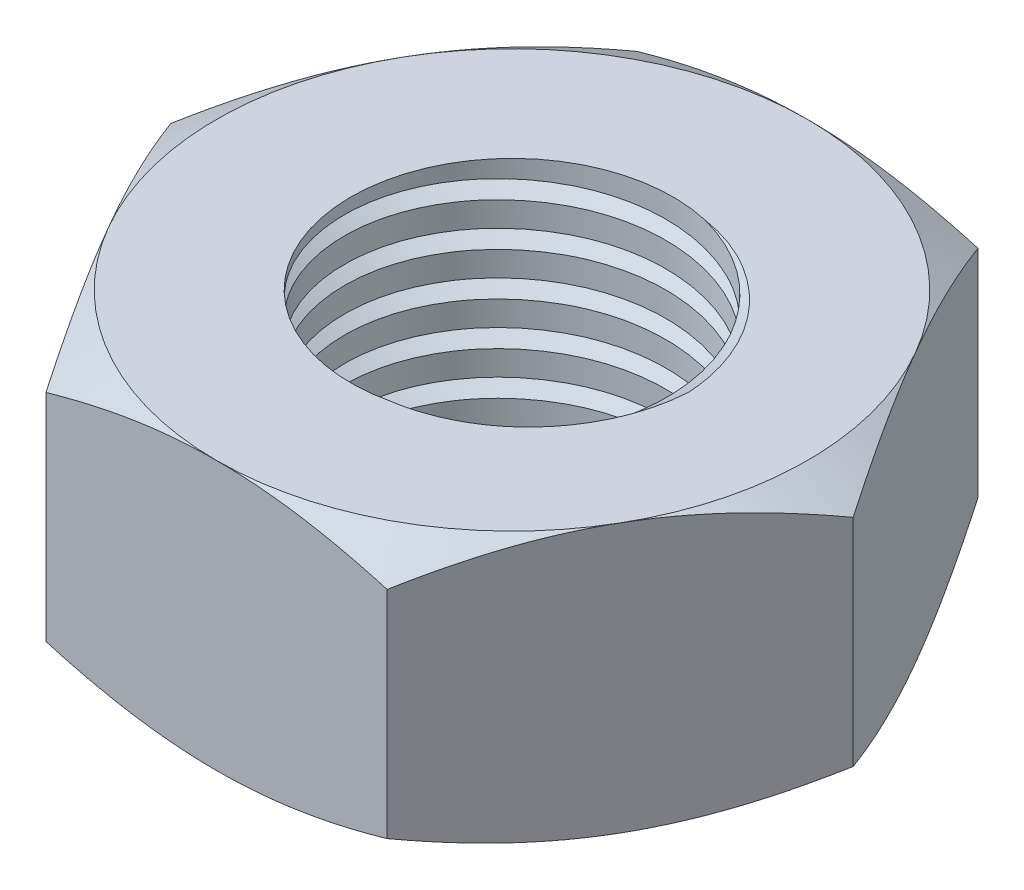
from build123d import *

# Parameters (mm, degrees)
BOSS_EXTRUDE1_DEPTH = 2.5
SKETCH2_R           = 1.5
CUT_EXTRUDE1_DEPTH  = 2.5
SKETCH3_OUTSIDE_W   = 11.836
SKETCH3_OUTSIDE_H   = 10.986
SKETCH3_OUTSIDE_R   = 2.75
CUT_EXTRUDE3_DEPTH  = 0.5
CUT_EXTRUDE3_DRAFT  = -60
SKETCH4_OUTSIDE_W   = 11.836
SKETCH4_OUTSIDE_H   = 10.986
SKETCH4_OUTSIDE_R   = 2.75
CUT_EXTRUDE4_DEPTH  = 0.5
CUT_EXTRUDE4_DRAFT  = -60
CUT_SWEEP1_PITCH    = 0.4


with BuildPart() as part:
    # Sketch1 → Boss-Extrude1 (new body)
    with BuildSketch(Plane(origin=(0, 0, 0), x_dir=(1, 0, 0), z_dir=(0, 1, 0))):
        Polygon((3.175426481, 0), (1.58771324, 2.75), (-1.58771324, 2.75), (-3.175426481, 0), (-1.58771324, -2.75), (1.58771324, -2.75), align=None)
    extrude(amount=BOSS_EXTRUDE1_DEPTH)

    # Sketch2 → Cut-Extrude1 (cut)
    with BuildSketch(Plane(origin=(0, 2.5, 0), x_dir=(1, 0, 0), z_dir=(0, 1, 0))):
        with Locations(Location((0, 0, 0), (0, 0, 270))):
            Circle(SKETCH2_R)
    extrude(amount=-CUT_EXTRUDE1_DEPTH, mode=Mode.SUBTRACT)


with BuildPart() as cut_extrude3_tool:
    # Sketch3 outside → Cut-Extrude3 (with draft: the straight prism first)
    with BuildSketch(Plane(origin=(0, 2.5, 0), x_dir=(1, 0, 0), z_dir=(0, 1, 0))):
        Rectangle(SKETCH3_OUTSIDE_W, SKETCH3_OUTSIDE_H)
        Circle(SKETCH3_OUTSIDE_R, mode=Mode.SUBTRACT)
    extrude(amount=-CUT_EXTRUDE3_DEPTH)
    # Cut-Extrude3: the draft: its side faces are tilted about the plane it starts from
    cut_extrude3_sides = [cut_extrude3_tool.faces().sort_by_distance(p)[0] for p in [
        (0, 2.25, 5.493),
        (5.918, 2.25, 0),
        (0, 2.25, -5.493),
        (-5.918, 2.25, 0),
        (-2.75, 2.25, 0),
    ]]
    draft(cut_extrude3_sides, Plane(origin=(0, 2.5, 0), x_dir=(1, 0, 0), z_dir=(0, 1, 0)), CUT_EXTRUDE3_DRAFT)


with BuildPart() as part_1:
    add(part.part)

    # Cut-Extrude3: cut by cut_extrude3_tool
    add(cut_extrude3_tool.part, mode=Mode.SUBTRACT)


with BuildPart() as cut_extrude4_tool:
    # Sketch4 outside → Cut-Extrude4 (with draft: the straight prism first)
    with BuildSketch(Plane.XZ):
        Rectangle(SKETCH4_OUTSIDE_W, SKETCH4_OUTSIDE_H)
        Circle(SKETCH4_OUTSIDE_R, mode=Mode.SUBTRACT)
    extrude(amount=-CUT_EXTRUDE4_DEPTH)
    # Cut-Extrude4: the draft: its side faces are tilted about the plane it starts from
    cut_extrude4_sides = [cut_extrude4_tool.faces().sort_by_distance(p)[0] for p in [
        (0, 0.25, -5.493),
        (5.918, 0.25, 0),
        (0, 0.25, 5.493),
        (-5.918, 0.25, 0),
        (-2.75, 0.25, 0),
    ]]
    draft(cut_extrude4_sides, Plane.XZ, CUT_EXTRUDE4_DRAFT)


with BuildPart() as part_2:
    add(part_1.part)

    # Cut-Extrude4: cut by cut_extrude4_tool
    add(cut_extrude4_tool.part, mode=Mode.SUBTRACT)

    # Cut-Sweep1: arcs per turn and ends read off the stored shape
    # Cut-Sweep1: the profile of 3DSketch1 screwed along a right-hand helix through 11 turns, 6 arcs to a turn; built about Z, then put on its axis
    cut_sweep1_z = Axis((0, 0, 0), (0, 0, 1))
    cut_sweep1_corners = [(1.352775681, 0, -0.23), (1.352775681, 0, -0.57), (1.647224319, 0, -0.4)]
    with BuildLine(mode=Mode.PRIVATE) as cut_sweep1_profile:
        Line(cut_sweep1_corners[0], cut_sweep1_corners[1])
        Line(cut_sweep1_corners[1], cut_sweep1_corners[2])
        Line(cut_sweep1_corners[2], cut_sweep1_corners[0])
    cut_sweep1_cap = Face(cut_sweep1_profile.wire())
    cut_sweep1_turn_angles = [0, 30, 60, 90, 120, 150, 180, 210, 240, 270, 300, 330, 360]
    cut_sweep1_turn_weights = [1, 0.8660254037844387, 1, 0.8660254037844387, 1, 0.8660254037844387, 1, 0.8660254037844387, 1, 0.8660254037844387, 1, 0.8660254037844387, 1]
    cut_sweep1_turn_rails = [Edge.make_bspline([Vector(p[0], p[1], 0).rotate(cut_sweep1_z, cut_sweep1_turn_angles[k]) / cut_sweep1_turn_weights[k] + Vector(0, 0, p[2] + CUT_SWEEP1_PITCH * cut_sweep1_turn_angles[k] / 360) for k in range(13)], [0, 0, 0, 1, 1, 2, 2, 3, 3, 4, 4, 5, 5, 6, 6, 6], 2, cut_sweep1_turn_weights) for p in cut_sweep1_corners]
    cut_sweep1_turn_sides = [Face.make_surface_from_curves(cut_sweep1_turn_rails[p[0]], cut_sweep1_turn_rails[p[1]]) for p in [(0, 1), (1, 2), (2, 0)]]
    cut_sweep1 = Plane(origin=(0, 2.5, 0), x_dir=(1, 0, 0), z_dir=(0, -1, 0)) * Solid(Shell([*[p.moved(Location((0, 0, CUT_SWEEP1_PITCH * i))) for i in range(11) for p in cut_sweep1_turn_sides], cut_sweep1_cap, cut_sweep1_cap.rotate(cut_sweep1_z, 3960).moved(Location((0, 0, CUT_SWEEP1_PITCH * 3960 / 360)))]))
    add(cut_sweep1, mode=Mode.SUBTRACT)


solid = part_2.part
